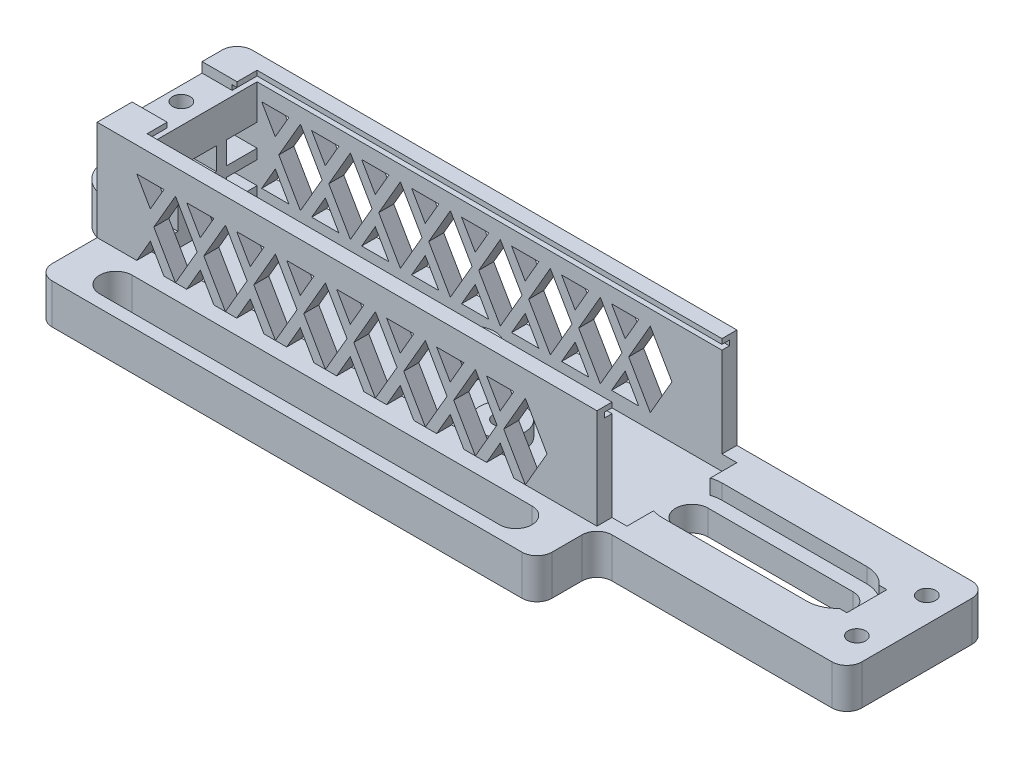
from build123d import *

# Parameters (mm, degrees)
SKIZZE1_W                            = 100
SKIZZE1_H                            = 40
AUFSATZ_LINEAR_AUSTRAGEN1_DEPTH      = 8
SKIZZE2_W                            = 23
SKIZZE2_H                            = 22
SKIZZE2_W_2                          = 7
SKIZZE2_H_2                          = 10
SCHNITT_LINEAR_AUSTRAGEN1_DEPTH      = 3
SKIZZE4_R                            = 1.75
SCHNITT_LINEAR_AUSTRAGEN2_DEPTH      = 55.442630355
SCHNITT_LINEAR_AUSTRAGEN3_DEPTH      = 3
AUFSATZ_LINEAR_AUSTRAGEN2_DEPTH      = 20
SCHNITT_LINEAR_AUSTRAGEN4_DEPTH      = 70.885620839
LINEARES_MUSTER1_COUNT               = 8
LINEARES_MUSTER1_PITCH               = 10
SKIZZE9_W                            = 25
SKIZZE9_H                            = 1
SCHNITT_LINEAR_AUSTRAGEN5_DEPTH      = 94
SCHNITT_LINEAR_START                 = -2
SKIZZE10_W                           = 7
SKIZZE10_H                           = 14
SCHNITT_LINEAR_AUSTRAGEN6_DEPTH      = 2
SCHNITT_LINEAR_START_2               = -3
SCHNITT_LINEAR_AUSTRAGEN7_DEPTH      = 3
SCHNITT_LINEAR_AUSTRAGEN8_DEPTH      = 8
SCHNITT_LINEAR_AUSTRAGEN8_DEPTH_BACK = 3
SKIZZE12_R                           = 1.75
SKIZZE13_W                           = 6.15
SKIZZE13_H                           = 4.5
SKIZZE13_W_2                         = 5.7
SCHNITT_LINEAR_AUSTRAGEN9_DEPTH      = 7
SCHNITT_LINEAR_AUSTRAGEN10_DEPTH     = 58.445626465
AUFSATZ_LINEAR_AUSTRAGEN3_DEPTH      = 50
SKIZZE16_W                           = 8
SKIZZE16_H                           = 3
AUFSATZ_LINEAR_AUSTRAGEN4_DEPTH      = 10
SKIZZE17_R                           = 1.75
SCHNITT_LINEAR_AUSTRAGEN11_DEPTH     = 104.923048454
SCHNITT_LINEAR_AUSTRAGEN12_DEPTH     = 3
VERRUNDUNG1_R                        = 3
SKIZZE19_W                           = 96
SKIZZE19_H                           = 22
SKIZZE19_R                           = 4.5
SCHNITT_LINEAR_AUSTRAGEN13_DEPTH     = 3
SKIZZE20_R                           = 3.25
AUFSATZ_LINEAR_AUSTRAGEN5_DEPTH      = 8
SCHNITT_LINEAR_AUSTRAGEN14_DEPTH     = 105.541857646
SCHNITT_LINEAR_AUSTRAGEN16_DEPTH     = 3


with BuildPart() as part:
    # Skizze1 → Aufsatz-Linear austragen1 (new body)
    with BuildSketch(Plane(origin=(0, 0, 0), x_dir=(1, 0, 0), z_dir=(0, 1, 0))):
        Rectangle(SKIZZE1_W, SKIZZE1_H)
    extrude(amount=AUFSATZ_LINEAR_AUSTRAGEN1_DEPTH)

    # Skizze2 → Schnitt-Linear austragen1 (cut)
    with BuildSketch(Plane(origin=(0, 8, 0), x_dir=(1, 0, 0), z_dir=(0, 1, 0))):
        with Locations((38.5, 6)):
            Rectangle(SKIZZE2_W, SKIZZE2_H)
        with Locations((-27.5, 6)):
            Rectangle(SKIZZE2_W_2, SKIZZE2_H_2)
    extrude(amount=-SCHNITT_LINEAR_AUSTRAGEN1_DEPTH, mode=Mode.SUBTRACT)

    # Skizze4 → Schnitt-Linear austragen2 (cut, through all)
    with BuildSketch(Plane(origin=(0, 8, 0), x_dir=(1, 0, 0), z_dir=(0, 1, 0))):
        with Locations(Location((6, 11, 0), (0, 0, 270))):
            Circle(SKIZZE4_R)
        with Locations(Location((22, 1, 0), (0, 0, 270))):
            Circle(SKIZZE4_R)
    extrude(amount=-SCHNITT_LINEAR_AUSTRAGEN2_DEPTH, mode=Mode.SUBTRACT)

    # Skizze5 → Schnitt-Linear austragen3 (cut)
    with BuildSketch(Plane.XZ):
        Polygon((2.709103466, -11), (4.354551733, -13.85), (7.645448267, -13.85), (9.290896534, -11), (7.645448267, -8.15), (4.354551733, -8.15), align=None)
        Polygon((18.709103466, -1), (20.354551733, -3.85), (23.645448267, -3.85), (25.290896534, -1), (23.645448267, 1.85), (20.354551733, 1.85), align=None)
    extrude(amount=-SCHNITT_LINEAR_AUSTRAGEN3_DEPTH, mode=Mode.SUBTRACT)

    # Skizze6 → Aufsatz-Linear austragen2 (add)
    with BuildSketch(Plane(origin=(0, 8, 0), x_dir=(1, 0, 0), z_dir=(0, 1, 0))):
        Polygon((50, 17), (50, 20), (-50, 20), (-50, -8), (50, -8), (50, -5), (-43, -5), (-43, 17), align=None)
    extrude(amount=AUFSATZ_LINEAR_AUSTRAGEN2_DEPTH)

    # Skizze7 → Schnitt-Linear austragen4 (cut, through all)
    with BuildSketch(Plane(origin=(0, 0, -20), x_dir=(-1, 0, 0), z_dir=(0, 0, -1))):
        Polygon((-35.669872981, 23), (-40, 15.5), (-35.669872981, 8), (-31.339745962, 15.5), align=None)
        Polygon((-33.360471904, 8), (-30.639745962, 12.712435565), (-27.91902002, 8), align=None)
        Polygon((-33.360471904, 23), (-30.639745962, 18.287564435), (-27.91902002, 23), align=None)
    schnitt_linear_austragen4 = extrude(amount=-SCHNITT_LINEAR_AUSTRAGEN4_DEPTH, mode=Mode.SUBTRACT)

    # Lineares Muster1: Schnitt-Linear austragen4 ×8
    with Locations(*[(-i * LINEARES_MUSTER1_PITCH, 0, 0) for i in range(1, LINEARES_MUSTER1_COUNT)]):
        add(schnitt_linear_austragen4, mode=Mode.SUBTRACT)

    # Skizze9 → Schnitt-Linear austragen5 (cut)
    with BuildSketch(Plane(origin=(50, 0, 0), x_dir=(0, 0, -1), z_dir=(1, 0, 0))):
        with Locations((6, 26.5)):
            Rectangle(SKIZZE9_W, SKIZZE9_H)
    extrude(amount=-SCHNITT_LINEAR_AUSTRAGEN5_DEPTH, mode=Mode.SUBTRACT)

    # Skizze10 → Schnitt-Linear austragen6 (cut)
    with BuildSketch(Plane(origin=(0, 28, 0), x_dir=(1, 0, 0), z_dir=(0, 1, 0)).offset(SCHNITT_LINEAR_START)):
        with Locations((-46.5, 6)):
            Rectangle(SKIZZE10_W, SKIZZE10_H)
    extrude(amount=SCHNITT_LINEAR_AUSTRAGEN6_DEPTH, mode=Mode.SUBTRACT)

    # Skizze11 → Schnitt-Linear austragen7 (cut)
    with BuildSketch(Plane(origin=(0, 26, 0), x_dir=(1, 0, 0), z_dir=(0, 1, 0)).offset(SCHNITT_LINEAR_START_2)):
        Polygon((-44.3, 4.354551733), (-44.3, 7.645448267), (-46.386344802, 8.85), (-50, 8.85), (-50, 3.15), (-46.386344802, 3.15), align=None)
    extrude(amount=-SCHNITT_LINEAR_AUSTRAGEN7_DEPTH, mode=Mode.SUBTRACT)

    # Skizze12 → Schnitt-Linear austragen8 (cut, two sides: drawn at the far end of the back side and taken through both)
    with BuildSketch(Plane.XZ.offset(-23).offset(-SCHNITT_LINEAR_AUSTRAGEN8_DEPTH_BACK)):
        with Locations(Location((-47.15, -6, 0), (0, 0, 90))):
            Circle(SKIZZE12_R)
    extrude(amount=SCHNITT_LINEAR_AUSTRAGEN8_DEPTH + SCHNITT_LINEAR_AUSTRAGEN8_DEPTH_BACK, mode=Mode.SUBTRACT)

    # Skizze13 → Schnitt-Linear austragen9 (cut)
    with BuildSketch(Plane.ZY.offset(50)):
        with Locations((-13.925, 16.75)):
            Rectangle(SKIZZE13_W, SKIZZE13_H)
        with Locations((-13.925, 10.25)):
            Rectangle(SKIZZE13_W, SKIZZE13_H)
        with Locations((1.925, 16.75)):
            Rectangle(SKIZZE13_W, SKIZZE13_H)
        with Locations((1.925, 10.25)):
            Rectangle(SKIZZE13_W, SKIZZE13_H)
        with Locations((-6, 16.75)):
            Rectangle(SKIZZE13_W_2, SKIZZE13_H)
        with Locations((-6, 10.25)):
            Rectangle(SKIZZE13_W_2, SKIZZE13_H)
    extrude(amount=-SCHNITT_LINEAR_AUSTRAGEN9_DEPTH, mode=Mode.SUBTRACT)

    # Skizze14 → Schnitt-Linear austragen10 (cut, through all)
    with BuildSketch(Plane(origin=(0, 8, 0), x_dir=(1, 0, 0), z_dir=(0, 1, 0))):
        with BuildLine():
            Line((-40, -11), (40, -11))
            ThreePointArc((40, -11), (43.25, -14.25), (40, -17.5))
            Line((40, -17.5), (-40, -17.5))
            ThreePointArc((-40, -17.5), (-43.25, -14.25), (-40, -11))
        make_face()
    extrude(amount=-SCHNITT_LINEAR_AUSTRAGEN10_DEPTH, mode=Mode.SUBTRACT)

    # Skizze15 → Aufsatz-Linear austragen3 (add)
    with BuildSketch(Plane(origin=(50, 0, 0), x_dir=(0, 0, -1), z_dir=(1, 0, 0))):
        Polygon((-8, 8), (-8, 0), (20, 0), (20, 8), (10, 8), (10, 5), (2, 5), (2, 8), align=None)
    extrude(amount=AUFSATZ_LINEAR_AUSTRAGEN3_DEPTH)

    # Skizze16 → Aufsatz-Linear austragen4 (add)
    with BuildSketch(Plane(origin=(100, 0, 0), x_dir=(0, 0, -1), z_dir=(1, 0, 0))):
        with Locations((6, 6.5)):
            Rectangle(SKIZZE16_W, SKIZZE16_H)
    extrude(amount=-AUFSATZ_LINEAR_AUSTRAGEN4_DEPTH)

    # Skizze17 → Schnitt-Linear austragen11 (cut, through all)
    with BuildSketch(Plane(origin=(0, 8, 0), x_dir=(1, 0, 0), z_dir=(0, 1, 0))):
        with Locations(Location((95, 13, 0), (0, 0, 270))):
            Circle(SKIZZE17_R)
        with Locations(Location((95, -1, 0), (0, 0, 270))):
            Circle(SKIZZE17_R)
    extrude(amount=-SCHNITT_LINEAR_AUSTRAGEN11_DEPTH, mode=Mode.SUBTRACT)

    # Skizze18 → Schnitt-Linear austragen12 (cut)
    with BuildSketch(Plane.XZ):
        Polygon((92.386631206, -1.000075885), (95.425432129, -2.263281708), (98.038800923, -0.263205822), (97.613368794, 3.000075885), (94.574567871, 4.263281708), (91.961199077, 2.263205822), align=None)
        Polygon((97.85, -14.645448267), (97.85, -11.354551733), (95, -9.709103466), (92.15, -11.354551733), (92.15, -14.645448267), (95, -16.290896534), align=None)
    extrude(amount=-SCHNITT_LINEAR_AUSTRAGEN12_DEPTH, mode=Mode.SUBTRACT)

    # Verrundung1
    # the kernel refuses this fillet: 3 mm, written as the material it adds along each edge
    with BuildSketch(Plane(origin=(50, 8, 8), x_dir=(0, 0, 1), z_dir=(0, -1, 0))) as verrundung1_piece_1:
        with BuildLine():
            CenterArc((VERRUNDUNG1_R, -VERRUNDUNG1_R), VERRUNDUNG1_R, 90, 90)
            Line((0, -VERRUNDUNG1_R), (0, 0))
            Line((0, 0), (VERRUNDUNG1_R, 0))
        make_face()
    extrude(amount=8)
    # the kernel refuses this fillet: 3 mm, written as the material it takes off along each edge
    with BuildSketch(Plane(origin=(50, -7.5, 20), x_dir=(-1, 0, 0), z_dir=(0, 1, 0))) as verrundung1_2_piece_1:
        with BuildLine():
            CenterArc((VERRUNDUNG1_R, -VERRUNDUNG1_R), VERRUNDUNG1_R, 90, 90)
            Line((0, -VERRUNDUNG1_R), (0, 0))
            Line((0, 0), (VERRUNDUNG1_R, 0))
        make_face()
    extrude(amount=23, mode=Mode.SUBTRACT)
    with BuildSketch(Plane(origin=(-50, -7.5, 20), x_dir=(1, 0, 0), z_dir=(0, 1, 0)), Plane(origin=(100, 15.5, 8), x_dir=(-1, 0, 0), z_dir=(0, -1, 0)), Plane(origin=(100, -7.5, -20), x_dir=(-1, 0, 0), z_dir=(0, 1, 0))) as verrundung1_2_piece_2:
        with BuildLine():
            CenterArc((VERRUNDUNG1_R, VERRUNDUNG1_R), VERRUNDUNG1_R, 180, 90)
            Line((0, VERRUNDUNG1_R), (0, 0))
            Line((0, 0), (VERRUNDUNG1_R, 0))
        make_face()
    extrude(amount=23, mode=Mode.SUBTRACT)
    with BuildSketch(Plane(origin=(-50, 35.5, -20), x_dir=(0, 0, 1), z_dir=(0, -1, 0))) as verrundung1_2_piece_3:
        with BuildLine():
            CenterArc((VERRUNDUNG1_R, -VERRUNDUNG1_R), VERRUNDUNG1_R, 90, 90)
            Line((0, -VERRUNDUNG1_R), (0, 0))
            Line((0, 0), (VERRUNDUNG1_R, 0))
        make_face()
    extrude(amount=43, mode=Mode.SUBTRACT)

    # Skizze19 → Schnitt-Linear austragen13 (cut)
    with BuildSketch(Plane(origin=(0, 8, 0), x_dir=(1, 0, 0), z_dir=(0, 1, 0))):
        with Locations((5, 6)):
            Rectangle(SKIZZE19_W, SKIZZE19_H)
        with Locations(Location((6, 11, 0), (0, 0, 270))):
            Circle(SKIZZE19_R, mode=Mode.SUBTRACT)
        with Locations(Location((22, 1, 0), (0, 0, 270))):
            Circle(SKIZZE19_R, mode=Mode.SUBTRACT)
    extrude(amount=-SCHNITT_LINEAR_AUSTRAGEN13_DEPTH, mode=Mode.SUBTRACT)

    # Skizze20 → Aufsatz-Linear austragen5 (add)
    with BuildSketch(Plane(origin=(0, 8, 0), x_dir=(1, 0, 0), z_dir=(0, 1, 0))):
        with BuildLine():
            Line((-56.25, 12.25), (-50, 12.25))
            Line((-50, 12.25), (-50, -0.25))
            Line((-50, -0.25), (-56.25, -0.25))
            ThreePointArc((-56.25, -0.25), (-62.5, 6), (-56.25, 12.25))
        make_face()
        with Locations(Location((-56.25, 6, 0), (0, 0, 270))):
            Circle(SKIZZE20_R, mode=Mode.SUBTRACT)
    extrude(amount=-AUFSATZ_LINEAR_AUSTRAGEN5_DEPTH)

    # Skizze21 → Schnitt-Linear austragen14 (cut, through all)
    with BuildSketch(Plane(origin=(0, 5, 0), x_dir=(1, 0, 0), z_dir=(0, 1, 0))):
        with BuildLine():
            Line((55, 9.25), (84, 9.25))
            ThreePointArc((84, 9.25), (87.25, 6), (84, 2.75))
            Line((84, 2.75), (55, 2.75))
            ThreePointArc((55, 2.75), (51.75, 6), (55, 9.25))
        make_face()
    extrude(amount=-SCHNITT_LINEAR_AUSTRAGEN14_DEPTH, mode=Mode.SUBTRACT)

    # Skizze22 → Schnitt-Linear austragen16 (cut)
    with BuildSketch(Plane(origin=(0, 5, 0), x_dir=(1, 0, 0), z_dir=(0, 1, 0))):
        with BuildLine():
            Line((55, 12), (84, 12))
            ThreePointArc((84, 12), (90, 6), (84, 0))
            Line((84, 0), (55, 0))
            ThreePointArc((55, 0), (49, 6), (55, 12))
        make_face()
    extrude(amount=SCHNITT_LINEAR_AUSTRAGEN16_DEPTH, mode=Mode.SUBTRACT)


solid = part.part
